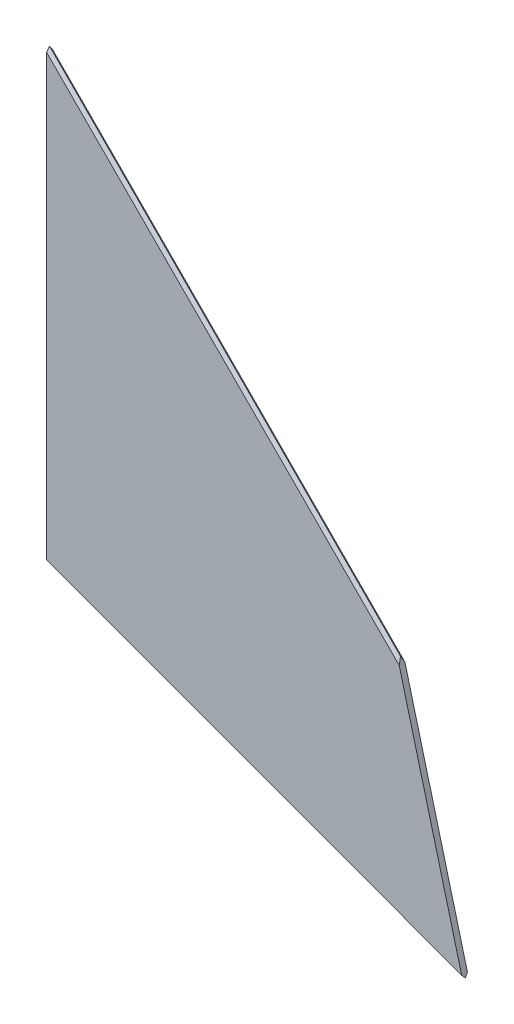
from build123d import *

# Parameters (mm, degrees)
BOSS_EXTRUDE1_DEPTH = 1.5
CHAMFER1_SIZE       = 1.5


with BuildPart() as part:
    # Sketch1 → Boss-Extrude1 (new, symmetric)
    with BuildSketch(Plane.XY):
        Polygon((0, 0), (0, 234), (184, 49), (218, -80), align=None)
    extrude(amount=BOSS_EXTRUDE1_DEPTH, both=True)

    # Chamfer1
    # the kernel refuses this chamfer: 1.5 mm, written as the material it takes off along each edge
    with BuildSketch(Plane(origin=(-2.720279639, 236.735063768, -1.5), x_dir=(0.01949513897586929, 0.01938975984627006, 0.9996219169112969), z_dir=(0.7051879131144355, -0.7090204561204898, 0)), Plane(origin=(-2.720279639, 236.735063768, 1.5), x_dir=(-0.708752387476486, -0.704921293490129, 0.027495876610586337), z_dir=(0.7051879131144355, -0.7090204561204898, 0))) as chamfer1_piece_1:
        Polygon((CHAMFER1_SIZE * 0.999621916911, CHAMFER1_SIZE * 0.0274958766106), (-CHAMFER1_SIZE * 0.0274958766106, CHAMFER1_SIZE * 0.999621916911), (0, 0), align=None)
    extrude(amount=268.638409359, mode=Mode.SUBTRACT)
    with BuildSketch(Plane(origin=(221.621380299, -81.328946899, -1.5), x_dir=(0.3443774504996801, 0.9384285526116285, -0.0274958766105866), z_dir=(-0.9387834907734437, 0.34450770303612605, 0))) as chamfer1_piece_2:
        Polygon((CHAMFER1_SIZE * 0.999621916911, -CHAMFER1_SIZE * 0.0274958766106), (-CHAMFER1_SIZE * 0.0274958766106, -CHAMFER1_SIZE * 0.999621916911), (0, 0), align=None)
    extrude(amount=239.930466195, mode=Mode.SUBTRACT)
    with BuildSketch(Plane(origin=(221.621380299, -81.328946899, 1.5), x_dir=(0.3443774504996801, 0.9384285526116285, 0.0274958766105866), z_dir=(-0.9387834907734437, 0.34450770303612605, 0))) as chamfer1_piece_3:
        Polygon((CHAMFER1_SIZE * 0.999621916911, CHAMFER1_SIZE * 0.0274958766106), (-CHAMFER1_SIZE * 0.0274958766106, CHAMFER1_SIZE * 0.999621916911), (0, 0), align=None)
    extrude(amount=239.930466195, mode=Mode.SUBTRACT)


solid = part.part
